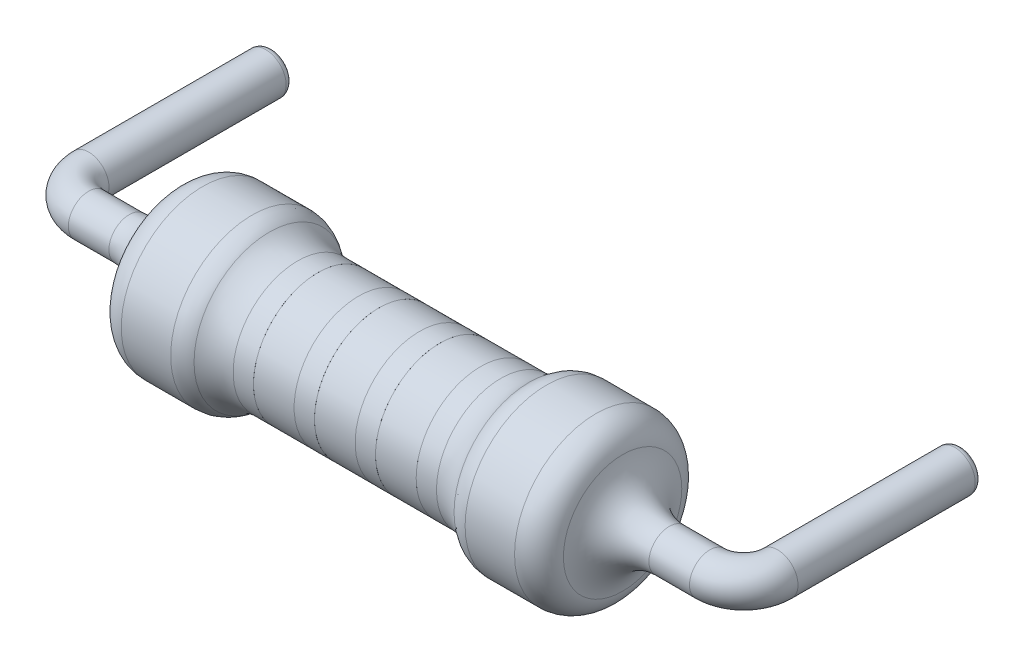
from build123d import *

# Parameters (mm, degrees)
IZIM2_R                                 = 0.3000000000000001
RADYUS4_R                               = 0.1
Y_KSEKLIK_EKSTR_ZYON2_START             = 2.55
IZIM4_R                                 = 1.2
Y_KSEKLIK_EKSTR_ZYON2_DEPTH             = 0.75
Y_KSEKLIK_EKSTR_ZYON3_START             = -2.55
IZIM4_3_R                               = 1.2
Y_KSEKLIK_EKSTR_ZYON3_DEPTH             = 0.75
Y_KSEKLIK_EKSTR_ZYON4_REACH             = 8.017
IZIM4_4_R                               = 0.95
Y_KSEKLIK_EKSTR_ZYON4_DIRECTION_2_REACH = 8.017
RADYUS1_R                               = 0.4
RADYUS2_R                               = 0.7
RADYUS3_R                               = 0.7
EKSTR_ZYON_NCE1_START                   = 1.2
IZIM4_5_R                               = 0.9504999999999999
IZIM4_5_R_2                             = 0.8494999999999999
EKSTR_ZYON_NCE1_DEPTH                   = 0.3
EKSTR_ZYON_NCE2_START                   = 0.6
IZIM4_7_R                               = 0.9504999999999999
IZIM4_7_R_2                             = 0.8494999999999999
EKSTR_ZYON_NCE2_DEPTH                   = 0.3
EKSTR_ZYON_NCE3_START                   = -0.3
IZIM4_9_R                               = 0.9504999999999999
IZIM4_9_R_2                             = 0.8494999999999999
EKSTR_ZYON_NCE3_DEPTH                   = 0.3
EKSTR_ZYON_NCE4_START                   = -1.2
IZIM4_10_R                              = 0.9504999999999999
IZIM4_10_R_2                            = 0.8494999999999999
EKSTR_ZYON_NCE4_DEPTH                   = 0.3


with BuildPart() as part:
    # Süpür2: sweep along a path in Çizim3
    with BuildLine(Plane(origin=(0, 0, 0), x_dir=(1, 0, 0), z_dir=(0, 1, 0))) as s_p_r2_path:
        Line((5.080000000000001, 2.0000000000000355), (5.080000000000001, -0.7129999999999246))
        ThreePointArc((5.080000000000001, -0.7129999999999246), (4.9335533905933, -1.0665533905932438), (4.580000000000001, -1.2129999999999947))
        Line((4.580000000000001, -1.2129999999999947), (-4.580000000000001, -1.2129999999999959))
        ThreePointArc((-4.580000000000001, -1.2129999999999959), (-4.933553390593275, -1.0665533905932696), (-5.080000000000001, -0.712999999999996))
        Line((-5.080000000000001, -0.712999999999996), (-5.080000000000001, 1.9999999999999645))
    # Çizim2 → Süpür2 (sweep)
    with BuildSketch(Plane(origin=(0, 0, -2), x_dir=(-1, 0, 6.98e-15), z_dir=(-6.98e-15, 0, -1))):
        with Locations((-5.080000000000001, 0)):
            Circle(IZIM2_R)
    sweep(path=s_p_r2_path.line)

    # Radyus4
    radyus4_edges = [part.edges().sort_by_distance(p)[0] for p in [
        (5.380000000000001, -4e-17, -2.0000000000000355),
        (-5.380000000000001, -4e-17, -1.9999999999999645),
    ]]
    fillet(radyus4_edges, radius=RADYUS4_R)

    # Çizim4 → Yükseklik-Ekstrüzyon2 (add, symmetric)
    with BuildSketch(Plane(origin=(0, 0, 0), x_dir=(0, 0, -1), z_dir=(1, 0, 0)).offset(Y_KSEKLIK_EKSTR_ZYON2_START)):
        with Locations((-1.2129999999999959, 0)):
            Circle(IZIM4_R)
    extrude(amount=Y_KSEKLIK_EKSTR_ZYON2_DEPTH, both=True)

    # Çizim4<3> → Yükseklik-Ekstrüzyon3 (add, symmetric)
    with BuildSketch(Plane(origin=(0, 0, 0), x_dir=(0, 0, -1), z_dir=(1, 0, 0)).offset(Y_KSEKLIK_EKSTR_ZYON3_START)):
        with Locations((-1.2129999999999959, 0)):
            Circle(IZIM4_3_R)
    extrude(amount=Y_KSEKLIK_EKSTR_ZYON3_DEPTH, both=True)

    # Yükseklik-Ekstrüzyon4: up to this face of the body (flat: up to its plane)
    y_kseklik_ekstr_zyon4_end = Plane(part.part.faces().sort_by_distance((1.8, 0, 2.379058875))[0])
    # Çizim4<4> → Yükseklik-Ekstrüzyon4 (add, up to the picked face)
    with BuildSketch(Plane(origin=(0, 0, 0), x_dir=(0, 0, -1), z_dir=(1, 0, 0)), mode=Mode.PRIVATE) as y_kseklik_ekstr_zyon4_sk1:
        with Locations((-1.2129999999999959, 0)):
            Circle(IZIM4_4_R)
    y_kseklik_ekstr_zyon4_tool1 = split(extrude(y_kseklik_ekstr_zyon4_sk1.sketch, amount=Y_KSEKLIK_EKSTR_ZYON4_REACH, mode=Mode.PRIVATE), bisect_by=y_kseklik_ekstr_zyon4_end, keep=Keep.BOTH, mode=Mode.PRIVATE)
    add(y_kseklik_ekstr_zyon4_tool1.solids().sort_by(Axis((0, 0, 1.213), (1, 0, 0)))[0])

    # Yükseklik-Ekstrüzyon4 direction 2: up to this face of the body (flat: up to its plane)
    y_kseklik_ekstr_zyon4_direction_2_end = Plane(part.part.faces().sort_by_distance((-1.8, 0, 2.379058875))[0])
    # Çizim4<4> → Yükseklik-Ekstrüzyon4 direction 2 (add, up to the picked face)
    with BuildSketch(Plane(origin=(0, 0, 0), x_dir=(0, 0, -1), z_dir=(1, 0, 0)), mode=Mode.PRIVATE) as y_kseklik_ekstr_zyon4_direction_2_sk1:
        with Locations((-1.2129999999999959, 0)):
            Circle(IZIM4_4_R)
    y_kseklik_ekstr_zyon4_direction_2_tool1 = split(extrude(y_kseklik_ekstr_zyon4_direction_2_sk1.sketch, amount=-Y_KSEKLIK_EKSTR_ZYON4_DIRECTION_2_REACH, mode=Mode.PRIVATE), bisect_by=y_kseklik_ekstr_zyon4_direction_2_end, keep=Keep.BOTH, mode=Mode.PRIVATE)
    add(y_kseklik_ekstr_zyon4_direction_2_tool1.solids().sort_by(Axis((0, 0, 1.213), (-1, 0, 0)))[0])

    # Radyus1
    # the kernel refuses this fillet: 0.4 mm, written as the material it takes off along each edge
    with BuildSketch(Plane(origin=(3.3, 0, 1.2129999999999959), x_dir=(0, 0, -1), z_dir=(0, -1, 0))) as radyus1_piece_1:
        with BuildLine():
            CenterArc((1.2 - RADYUS1_R, -RADYUS1_R), RADYUS1_R, 0, 90)
            Line((1.2000000000000002, -RADYUS1_R), (1.2 + RADYUS1_R * 0.02, -RADYUS1_R))
            Line((1.2 + RADYUS1_R * 0.02, -RADYUS1_R), (1.2 + RADYUS1_R * 0.02, RADYUS1_R * 0.02))
            Line((1.2 + RADYUS1_R * 0.02, RADYUS1_R * 0.02), (1.2 - RADYUS1_R, RADYUS1_R * 0.02))
            Line((1.2 - RADYUS1_R, RADYUS1_R * 0.02), (1.2 - RADYUS1_R, 0))
        make_face()
    revolve(axis=Axis((3.3, 0, 1.2129999999999959), (1, 0, 0)), mode=Mode.SUBTRACT)
    with BuildSketch(Plane(origin=(1.7999999999999998, 0, 1.2129999999999959), x_dir=(0, 0, -1), z_dir=(0, -1, 0))) as radyus1_piece_2:
        with BuildLine():
            CenterArc((0.7999999999999999, 0.3708099243547833), RADYUS1_R, 292.02431283704215, 67.97568716295785)
            Line((0.95, 2.2e-16), (0.9529999999999998, -0.00741619848709552))
            ThreePointArc((0.9529999999999998, -0.00741619848709552), (1.075, -0.00800000000000001), (1.2, -0.00800000000000001))
            Line((1.2, -0.00800000000000001), (1.208, 0))
            Line((1.208, 0), (1.208, 0.3708099243547833))
            Line((1.208, 0.3708099243547833), (1.2, 0.3708099243547833))
        make_face()
    revolve(axis=Axis((1.7999999999999998, 0, 1.2129999999999959), (1, 0, 0)), mode=Mode.SUBTRACT)
    with BuildSketch(Plane(origin=(-1.7999999999999998, 0, 1.2129999999999959), x_dir=(0, 0, -1), z_dir=(0, -1, 0))) as radyus1_piece_3:
        with BuildLine():
            CenterArc((0.7999999999999999, -0.3708099243547833), RADYUS1_R, 0, 67.97568716295785)
            Line((1.2, -0.3708099243547833), (1.208, -0.3708099243547833))
            Line((1.208, -0.3708099243547833), (1.208, 0))
            Line((1.208, 0), (1.2, 0.00800000000000001))
            ThreePointArc((1.2, 0.00800000000000001), (1.075, 0.00800000000000001), (0.9529999999999998, 0.00741619848709552))
            Line((0.9529999999999998, 0.00741619848709552), (0.95, -2.2e-16))
        make_face()
    revolve(axis=Axis((-1.7999999999999998, 0, 1.2129999999999959), (1, 0, 0)), mode=Mode.SUBTRACT)
    with BuildSketch(Plane(origin=(-3.3, 0, 1.2129999999999959), x_dir=(0, 0, -1), z_dir=(0, -1, 0))) as radyus1_piece_4:
        with BuildLine():
            CenterArc((1.2 - RADYUS1_R, RADYUS1_R), RADYUS1_R, 270, 90)
            Line((1.2 - RADYUS1_R, 0), (1.2 - RADYUS1_R, -RADYUS1_R * 0.02))
            Line((1.2 - RADYUS1_R, -RADYUS1_R * 0.02), (1.2 + RADYUS1_R * 0.02, -RADYUS1_R * 0.02))
            Line((1.2 + RADYUS1_R * 0.02, -RADYUS1_R * 0.02), (1.2 + RADYUS1_R * 0.02, RADYUS1_R))
            Line((1.2 + RADYUS1_R * 0.02, RADYUS1_R), (1.2, RADYUS1_R))
        make_face()
    revolve(axis=Axis((-3.3, 0, 1.2129999999999959), (1, 0, 0)), mode=Mode.SUBTRACT)

    # Radyus2
    # the kernel refuses this fillet: 0.7 mm, written as the material it adds along each edge
    with BuildSketch(Plane(origin=(3.3, 0, 1.212999999999995), x_dir=(0, 0, -1), z_dir=(0, 1, 0))) as radyus2_piece_1:
        with BuildLine():
            CenterArc((1.0000000000000002, -0.6816653826391961), RADYUS2_R, 100.47568169639018, 79.52431830360979)
            Line((0.8727272727272696, 0.00666713358574667), (0.8599999999999965, 0.07550038520824076))
            ThreePointArc((0.8599999999999965, 0.07550038520824076), (0.7999999999999948, 0.06999999999999984), (0.30000000000000004, 0.06999999999999984))
            Line((0.30000000000000004, 0.06999999999999984), (0.2300000000000001, 0))
            Line((0.2300000000000001, 0), (0.23000000000000032, -0.6816653826391961))
            Line((0.23000000000000032, -0.6816653826391961), (0.30000000000000027, -0.6816653826391961))
        make_face()
    revolve(axis=Axis((3.3, 0, 1.212999999999995), (-1, 0, 2.2e-16)))
    with BuildSketch(Plane(origin=(-3.3, 0, 1.2129999999999965), x_dir=(0, 0, -1), z_dir=(0, 1, 0))) as radyus2_piece_2:
        with BuildLine():
            CenterArc((0.9999999999999998, 0.6816653826391965), RADYUS2_R, 180.00000000000009, 79.52431830360985)
            Line((0.2999999999999998, 0.6816653826391956), (0.22999999999999987, 0.6816653826391956))
            Line((0.22999999999999987, 0.6816653826391956), (0.2300000000000001, 0))
            Line((0.2300000000000001, 0), (0.30000000000000004, -0.06999999999999984))
            ThreePointArc((0.30000000000000004, -0.06999999999999984), (0.7999999999999963, -0.06999999999999984), (0.8599999999999974, -0.07550038520824032))
            Line((0.8599999999999974, -0.07550038520824032), (0.8727272727272704, -0.00666713358574622))
        make_face()
    revolve(axis=Axis((-3.3, 0, 1.2129999999999965), (-1, 0, 2.2e-16)))

    # Radyus3
    radyus3_edges = [part.edges().sort_by_distance(p)[0] for p in [
        (1.7999999999999998, -1.2e-16, 2.162999999999996),
        (-1.7999999999999998, 1.2e-16, 2.162999999999996),
    ]]
    fillet(radyus3_edges, radius=RADYUS3_R)

    # Çizim4<5> → Ekstrüzyon-İnce1 (add)
    with BuildSketch(Plane(origin=(0, 0, 0), x_dir=(0, 0, -1), z_dir=(1, 0, 0)).offset(EKSTR_ZYON_NCE1_START)):
        with Locations((-1.2129999999999959, 0)):
            Circle(IZIM4_5_R)
        with Locations((-1.2129999999999959, 0)):
            Circle(IZIM4_5_R_2, mode=Mode.SUBTRACT)
    extrude(amount=-EKSTR_ZYON_NCE1_DEPTH)

    # Çizim4<7> → Ekstrüzyon-İnce2 (add)
    with BuildSketch(Plane(origin=(0, 0, 0), x_dir=(0, 0, -1), z_dir=(1, 0, 0)).offset(EKSTR_ZYON_NCE2_START)):
        with Locations((-1.2129999999999959, 0)):
            Circle(IZIM4_7_R)
        with Locations((-1.2129999999999959, 0)):
            Circle(IZIM4_7_R_2, mode=Mode.SUBTRACT)
    extrude(amount=-EKSTR_ZYON_NCE2_DEPTH)

    # Çizim4<9> → Ekstrüzyon-İnce3 (add)
    with BuildSketch(Plane(origin=(0, 0, 0), x_dir=(0, 0, -1), z_dir=(1, 0, 0)).offset(EKSTR_ZYON_NCE3_START)):
        with Locations((-1.2129999999999959, 0)):
            Circle(IZIM4_9_R)
        with Locations((-1.2129999999999959, 0)):
            Circle(IZIM4_9_R_2, mode=Mode.SUBTRACT)
    extrude(amount=-EKSTR_ZYON_NCE3_DEPTH)

    # Çizim4<10> → Ekstrüzyon-İnce4 (add)
    with BuildSketch(Plane(origin=(0, 0, 0), x_dir=(0, 0, -1), z_dir=(1, 0, 0)).offset(EKSTR_ZYON_NCE4_START)):
        with Locations((-1.2129999999999959, 0)):
            Circle(IZIM4_10_R)
        with Locations((-1.2129999999999959, 0)):
            Circle(IZIM4_10_R_2, mode=Mode.SUBTRACT)
    extrude(amount=-EKSTR_ZYON_NCE4_DEPTH)


solid = part.part
